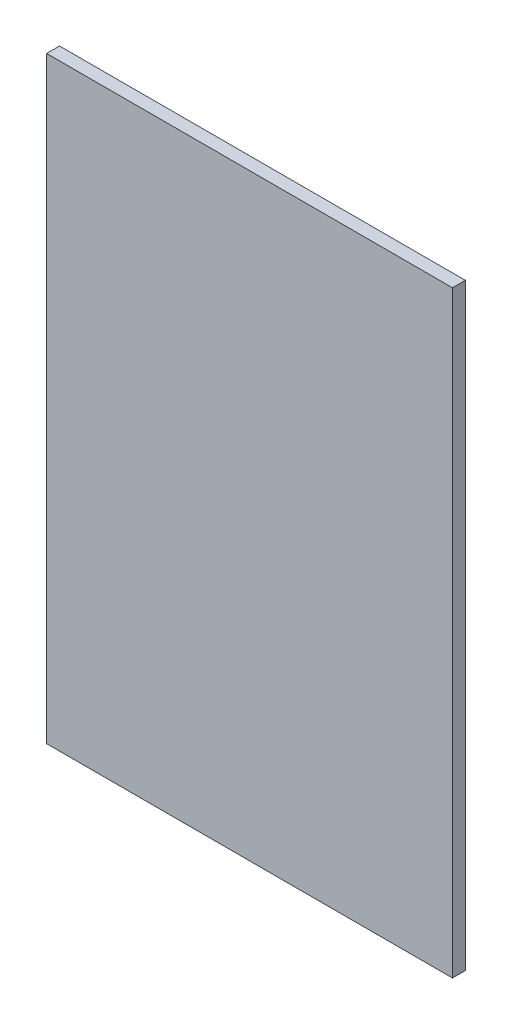
from build123d import *

# Parameters (mm, degrees)
BOSS_EXTRUDE1_DEPTH = 3.18


with BuildPart() as part:
    # Sketch1 → Boss-Extrude1 (new body)
    with BuildSketch(Plane.XY):
        Polygon((-50, 73.645), (-16.666666667, 73.645), (16.666666667, 73.645), (50, 73.645), (50, -73.645), (-50, -73.645), align=None)
    extrude(amount=BOSS_EXTRUDE1_DEPTH)


solid = part.part
